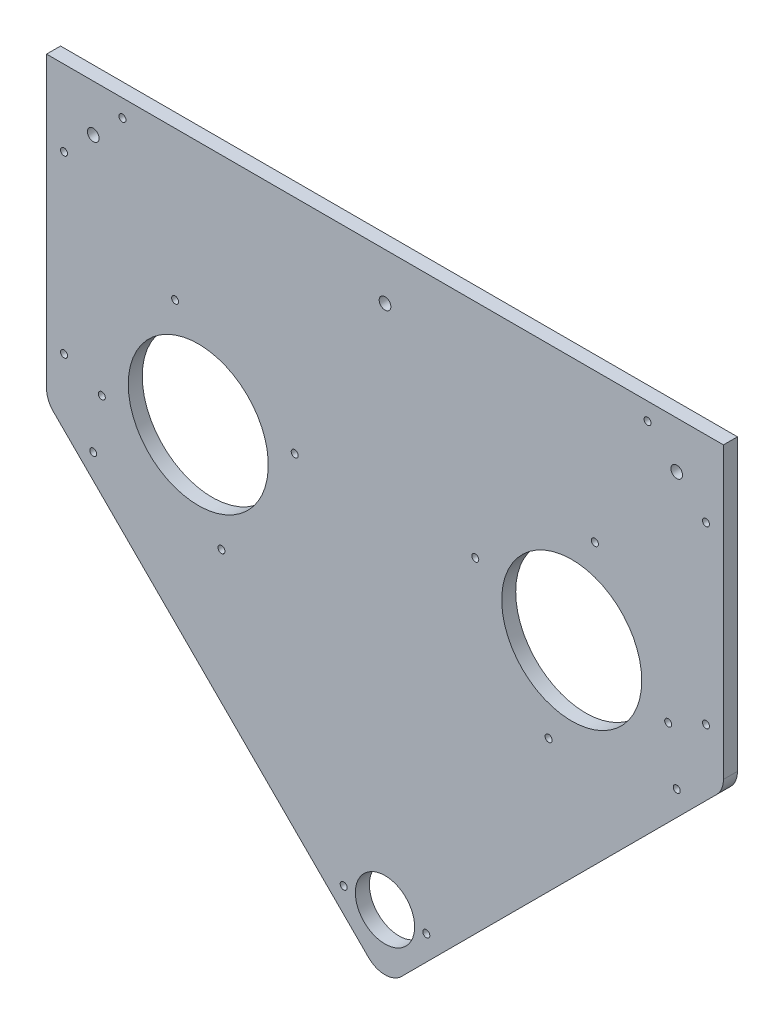
from build123d import *

# Parameters (mm, degrees)
SKETCH1_R           = 12.7
SKETCH1_R_2         = 1.5
SKETCH1_R_3         = 2.5
BOSS_EXTRUDE1_DEPTH = 6
FILLET1_R           = 10
SKETCH2_R           = 1.5
SKETCH2_R_2         = 30
CUT_EXTRUDE1_DEPTH  = 10


with BuildPart() as part:
    # Sketch1 → Boss-Extrude1 (new body)
    with BuildSketch(Plane.XY):
        Polygon((-145, 120), (145, 120), (145, -8.284271247), (0, -153.284271247), (-145, -8.284271247), align=None)
        with Locations((0, -125)):
            Circle(SKETCH1_R, mode=Mode.SUBTRACT)
        with Locations((-137.515790027, 87.484209973)):
            Circle(SKETCH1_R_2, mode=Mode.SUBTRACT)
        with Locations((-112.484209973, 112.515790027)):
            Circle(SKETCH1_R_2, mode=Mode.SUBTRACT)
        with Locations((-137.515790027, 12.515790027)):
            Circle(SKETCH1_R_2, mode=Mode.SUBTRACT)
        with Locations((-125, -17.7)):
            Circle(SKETCH1_R_2, mode=Mode.SUBTRACT)
        with Locations((-17.7, -125)):
            Circle(SKETCH1_R_2, mode=Mode.SUBTRACT)
        with Locations((17.7, -125)):
            Circle(SKETCH1_R_2, mode=Mode.SUBTRACT)
        with Locations((125, -17.7)):
            Circle(SKETCH1_R_2, mode=Mode.SUBTRACT)
        with Locations((137.515790027, 12.515790027)):
            Circle(SKETCH1_R_2, mode=Mode.SUBTRACT)
        with Locations((137.515790027, 87.484209973)):
            Circle(SKETCH1_R_2, mode=Mode.SUBTRACT)
        with Locations((112.484209973, 112.515790027)):
            Circle(SKETCH1_R_2, mode=Mode.SUBTRACT)
        with Locations((0, 100)):
            Circle(SKETCH1_R_3, mode=Mode.SUBTRACT)
        with Locations((-125, 100)):
            Circle(SKETCH1_R_3, mode=Mode.SUBTRACT)
        with Locations((125, 100)):
            Circle(SKETCH1_R_3, mode=Mode.SUBTRACT)
    extrude(amount=BOSS_EXTRUDE1_DEPTH)

    # Fillet1
    fillet1_edges = [part.edges().sort_by_distance(p)[0] for p in [
        (-145, -8.284271247, 3),
        (145, -8.284271247, 3),
        (0, -153.284271247, 3),
    ]]
    fillet(fillet1_edges, radius=FILLET1_R)

    # Sketch2 → Cut-Extrude1 (cut)
    with BuildSketch(Plane.XY.offset(6)):
        with Locations((38.67402397, 24.920368197)):
            Circle(SKETCH2_R)
        with Locations((89.920368197, 56.32597603)):
            Circle(SKETCH2_R)
        with Locations((121.32597603, 5.079631803)):
            Circle(SKETCH2_R)
        with Locations((70.079631803, -26.32597603)):
            Circle(SKETCH2_R)
        with Locations((80, 15)):
            Circle(SKETCH2_R_2)
        with Locations((-38.67402397, 24.920368197)):
            Circle(SKETCH2_R)
        with Locations((-89.920368197, 56.32597603)):
            Circle(SKETCH2_R)
        with Locations((-70.079631803, -26.32597603)):
            Circle(SKETCH2_R)
        with Locations((-121.32597603, 5.079631803)):
            Circle(SKETCH2_R)
        with Locations((-80, 15)):
            Circle(SKETCH2_R_2)
    extrude(amount=-CUT_EXTRUDE1_DEPTH, mode=Mode.SUBTRACT)


solid = part.part
